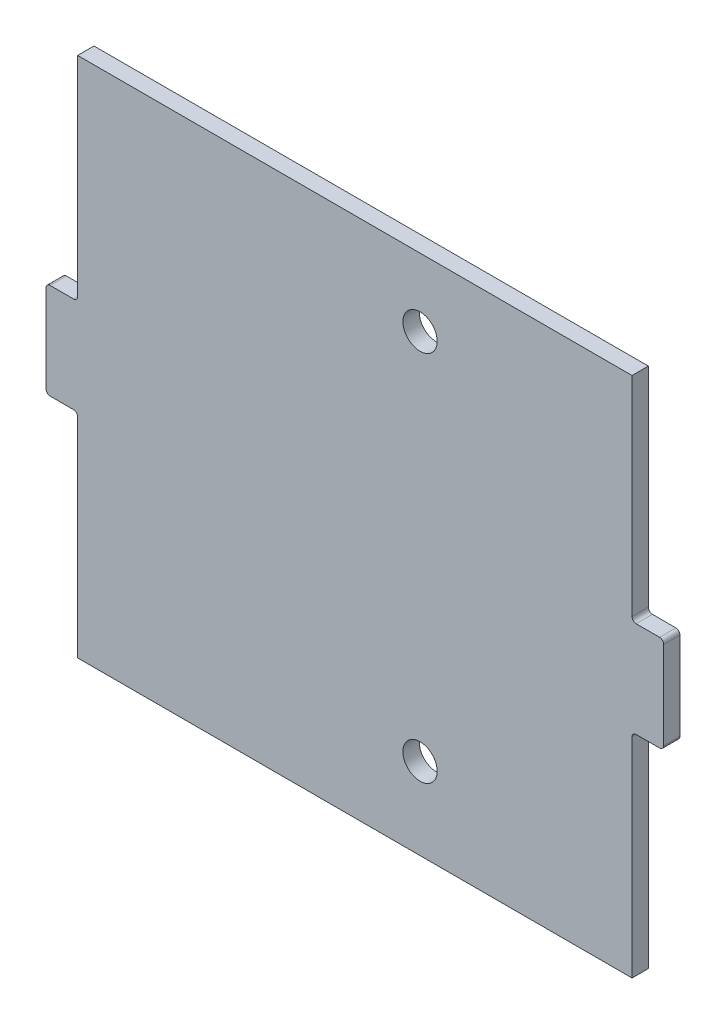
from build123d import *

# Parameters (mm, degrees)
BOSS_EXTRUDE1_DEPTH = 6.35
CAVITY1_START       = -6.35
CAVITY1_OUTLINE_R   = 12.7
CAVITY1_DEPTH       = 12.7
MOVE_FACE_SLOT_BY   = 0.762
MOVE_FACE_SLOT_2_BY = 0.762
MOVE_FACE_SLOT_3_BY = 0.762
MOVE_FACE_SLOT_4_BY = 0.762
MOVE_FACE_SLOT_5_BY = 0.762
MOVE_FACE_SLOT_6_BY = 0.762
FILLET1_R           = 3.175
MOVE_FACE_HOLE_BY   = 0.635
MOVE_FACE_HOLE_2_BY = 0.635


# Read off the part's stored shape, not the designer's step: Cavity1
with BuildPart() as part:
    # Sketch1 → Boss-Extrude1 (new, symmetric)
    with BuildSketch(Plane.XY):
        Polygon((-215.9, -38.1), (-215.9, -203.2), (215.9, -203.2), (215.9, -38.1), (241.3, -38.1), (241.3, 38.1), (215.9, 38.1), (215.9, 203.2), (-215.9, 203.2), (-215.9, 38.1), (-241.3, 38.1), (-241.3, -38.1), align=None)
    extrude(amount=BOSS_EXTRUDE1_DEPTH, both=True)

    # Cavity1 outline → Cavity1 (cut)
    with BuildSketch(Plane.XY.offset(CAVITY1_START)):
        with Locations((50.8, -139.7)):
            Circle(CAVITY1_OUTLINE_R)
        with Locations((50.8, 150.3)):
            Circle(CAVITY1_OUTLINE_R)
    extrude(amount=CAVITY1_DEPTH, mode=Mode.SUBTRACT)

    # Move Face slot: a face moved inward by 0.762
    extrude(part.faces().sort_by_distance((241.3, 0, 0))[0], amount=MOVE_FACE_SLOT_BY, dir=(-1, 0, 0), mode=Mode.SUBTRACT)

    # Move Face slot 2: a face moved inward by 0.762
    extrude(part.faces().sort_by_distance((228.6, 38.1, 0))[0], amount=MOVE_FACE_SLOT_2_BY, dir=(0, -1, 0), mode=Mode.SUBTRACT)

    # Move Face slot 3: a face moved inward by 0.762
    extrude(part.faces().sort_by_distance((-228.6, 38.1, 0))[0], amount=MOVE_FACE_SLOT_3_BY, dir=(0, -1, 0), mode=Mode.SUBTRACT)

    # Move Face slot 4: a face moved inward by 0.762
    extrude(part.faces().sort_by_distance((-241.3, 0, 0))[0], amount=MOVE_FACE_SLOT_4_BY, dir=(1, 0, 0), mode=Mode.SUBTRACT)

    # Move Face slot 5: a face moved inward by 0.762
    extrude(part.faces().sort_by_distance((-228.6, -38.1, 0))[0], amount=MOVE_FACE_SLOT_5_BY, dir=(0, 1, 0), mode=Mode.SUBTRACT)

    # Move Face slot 6: a face moved inward by 0.762
    extrude(part.faces().sort_by_distance((228.6, -38.1, 0))[0], amount=MOVE_FACE_SLOT_6_BY, dir=(0, 1, 0), mode=Mode.SUBTRACT)

    # Fillet1
    fillet1_edges = [part.edges().sort_by_distance(p)[0] for p in [
        (215.9, -37.338, 0),
        (240.538, -37.338, 0),
        (240.538, 37.338, 0),
        (215.9, 37.338, 0),
        (-215.9, 37.338, 0),
        (-240.538, 37.338, 0),
        (-240.538, -37.338, 0),
        (-215.9, -37.338, 0),
    ]]
    fillet(fillet1_edges, radius=FILLET1_R)

    # Move Face hole: a curved face moved inward by 0.635
    add(Solid.thicken(part.faces().sort_by_distance((38.1, -139.7, 0))[0], -MOVE_FACE_HOLE_BY), mode=Mode.SUBTRACT)

    # Move Face hole 2: a curved face moved inward by 0.635
    add(Solid.thicken(part.faces().sort_by_distance((38.1, 150.3, 0))[0], -MOVE_FACE_HOLE_2_BY), mode=Mode.SUBTRACT)


solid = part.part
